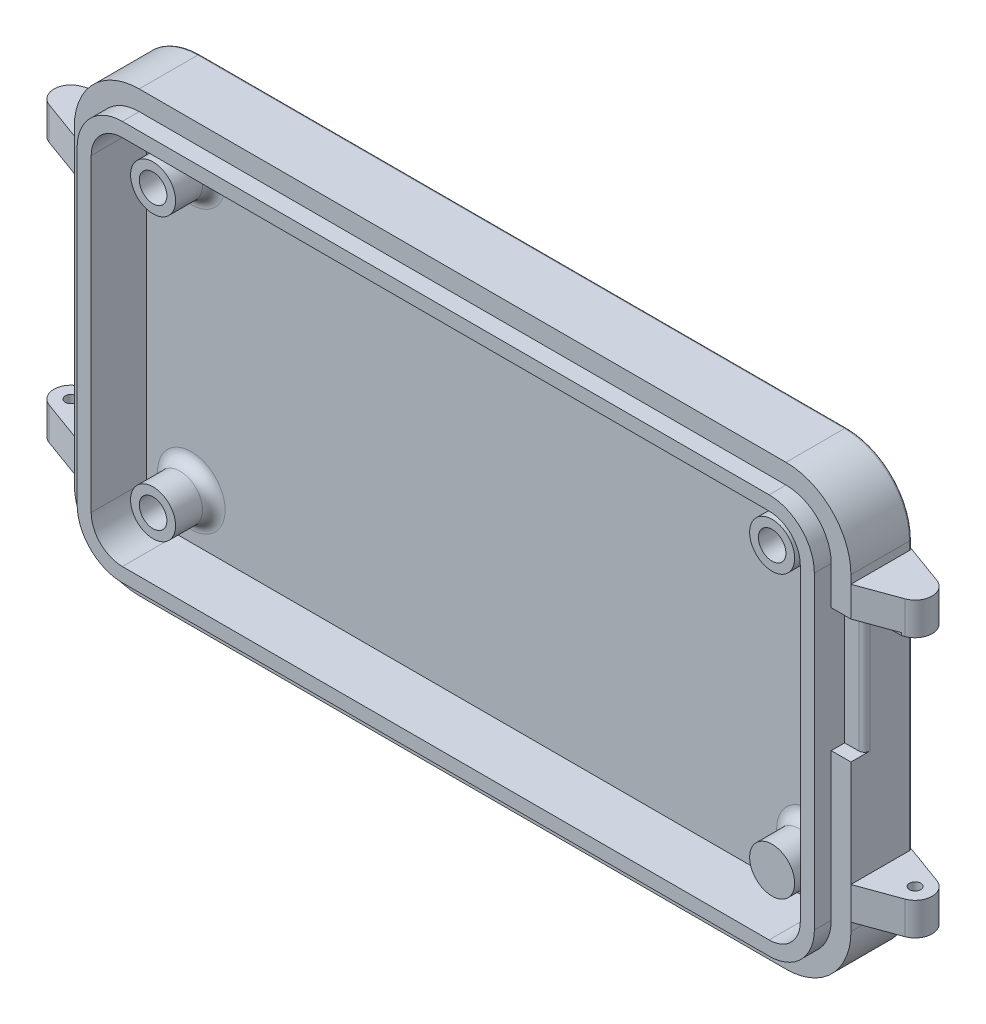
from build123d import *

# Parameters (mm, degrees)
EXTRUDE_1_DEPTH                 = 2
SKETCH_2_R                      = 2
SKETCH_2_R_2                    = 1.225
EXTRUDE_2_DEPTH                 = 3.4
FILLET_1_R                      = 1
EXTRUDE_3_DEPTH                 = 3.4
EXTRUDE_4_DEPTH                 = 1.5
EXTRUDE_START                   = -13
EXTRUDE_5_OUTLINE_R             = 0.5
EXTRUDE_5_DEPTH                 = 26
SKETCH_7_R                      = 0.5
EXTRUDE_6_DEPTH                 = 1
SKETCH_6_5_R                    = 1.511110367
CUT_EXTRUDE_2_DEPTH             = 10.1
CUT_EXTRUDE_START               = -10.1
CUT_EXTRUDE_3_DEPTH             = 20.2
EXTRUDE_START_2                 = -1
SKETCH_8_R                      = 0.5
EXTRUDE_7_DEPTH                 = 1
FILLET_12_R                     = 0.2
FILLET_13_R                     = 0.2
FILLET_14_R                     = 0.2
FILLET_15_R                     = 0.2
CUT_EXTRUDE_4_REACH             = 98.601
SKETCH_9_W                      = 8
SKETCH_9_H                      = 11
CUT_EXTRUDE_4_DIRECTION_2_DEPTH = 10
FILLET_20_R                     = 0.5


# Read off the part's stored shape, not the designer's step: 填料-伸長5, 除料-伸長3
with BuildPart() as part:
    # 草圖1 → 填料-伸長1 (new body)
    # profile 1 of 2: a face of its own
    with BuildSketch(Plane(origin=(0, 0, 52.444102468), x_dir=(-1, 0, 0), z_dir=(0, 0, -1))):
        with BuildLine():
            Line((-31.373871627, -18.844561135), (26.086442071, -18.844561135))
            ThreePointArc((26.086442071, -18.844561135), (30.166267544, -17.154541644), (31.856287034, -13.074716171))
            Line((31.856287034, -13.074716171), (31.856287035, 14.385591758))
            ThreePointArc((31.856287035, 14.385591758), (30.166268145, 18.465419031), (26.08644126, 20.155438855))
            Line((26.08644126, 20.155438855), (-31.373870816, 20.155438854))
            ThreePointArc((-31.373870816, 20.155438854), (-35.453692779, 18.465418678), (-37.143712955, 14.385596715))
            Line((-37.143712955, 14.385596715), (-37.143712955, -13.074721129))
            ThreePointArc((-37.143712955, -13.074721129), (-35.453692177, -17.154541292), (-31.373871627, -18.844561135))
        make_face()
        with BuildLine():
            ThreePointArc((26.086287059, -14.34456114), (26.984287031, -13.972561131), (27.35628704, -13.074561159))
            Line((27.35628704, -13.074561159), (27.35628704, 14.385438402))
            ThreePointArc((27.35628704, 14.385438402), (26.984287334, 15.283438817), (26.086287059, 15.65543886))
            Line((26.086287059, 15.65543886), (-31.373712502, 15.65543886))
            ThreePointArc((-31.373712502, 15.65543886), (-32.271712266, 15.283438166), (-32.64371296, 14.385438402))
            Line((-32.64371296, 14.385438402), (-32.64371296, -13.074561159))
            ThreePointArc((-32.64371296, -13.074561159), (-32.271711963, -13.97256048), (-31.373712502, -14.34456114))
            Line((-31.373712502, -14.34456114), (26.086287059, -14.34456114))
        make_face(mode=Mode.SUBTRACT)
    # profile 2 of 2: a face of its own
    with BuildSketch(Plane(origin=(0, 0, 52.444102468), x_dir=(-1, 0, 0), z_dir=(0, 0, -1))):
        with BuildLine():
            Line((-31.373712502, -14.34456114), (26.086287059, -14.34456114))
            ThreePointArc((26.086287059, -14.34456114), (26.984287031, -13.972561131), (27.35628704, -13.074561159))
            Line((27.35628704, -13.074561159), (27.35628704, 14.385438402))
            ThreePointArc((27.35628704, 14.385438402), (26.984287334, 15.283438817), (26.086287059, 15.65543886))
            Line((26.086287059, 15.65543886), (-31.373712502, 15.65543886))
            ThreePointArc((-31.373712502, 15.65543886), (-32.271712266, 15.283438166), (-32.64371296, 14.385438402))
            Line((-32.64371296, 14.385438402), (-32.64371296, -13.074561159))
            ThreePointArc((-32.64371296, -13.074561159), (-32.271711963, -13.97256048), (-31.373712502, -14.34456114))
        make_face()
    extrude(amount=-EXTRUDE_1_DEPTH)

    # 草圖2 → 填料-伸長2 (add)
    # profile 1 of 4: a face of its own
    with BuildSketch(Plane.XY.offset(54.444102468)):
        with Locations(Location((-24.85628696, -11.84456106, 0), (0, 0, 180))):
            Circle(SKETCH_2_R)
        with Locations((-24.85628696, -11.84456106)):
            Circle(SKETCH_2_R_2, mode=Mode.SUBTRACT)
    # profile 2 of 4: a face of its own
    with BuildSketch(Plane.XY.offset(54.444102468)):
        with Locations(Location((-24.85628696, 13.15543974, 0), (0, 0, 180))):
            Circle(SKETCH_2_R)
        with Locations((-24.85628696, 13.15543974)):
            Circle(SKETCH_2_R_2, mode=Mode.SUBTRACT)
    # profile 3 of 4: a face of its own
    with BuildSketch(Plane.XY.offset(54.444102468)):
        with Locations(Location((30.14371226, 13.15543974, 0), (0, 0, 180))):
            Circle(SKETCH_2_R)
        with Locations((30.14371226, 13.15543974)):
            Circle(SKETCH_2_R_2, mode=Mode.SUBTRACT)
    # profile 4 of 4: a face of its own
    with BuildSketch(Plane.XY.offset(54.444102468)):
        with Locations(Location((30.14371304, -11.84456026, 0), (0, 0, 180))):
            Circle(SKETCH_2_R)
    extrude(amount=EXTRUDE_2_DEPTH)

    # 圓角1
    fillet_1_edges = [part.edges().sort_by_distance(p)[0] for p in [
        (32.14371226, 13.15543974, 54.444102468),
        (-22.85628696, 13.15543974, 54.444102468),
        (-22.85628696, -11.84456106, 54.444102468),
        (32.14371304, -11.84456026, 54.444102468),
    ]]
    fillet(fillet_1_edges, radius=FILLET_1_R)

    # 草圖4 → 填料-伸長3 (add)
    with BuildSketch(Plane.XY.offset(54.444102468)):
        with BuildLine():
            Line((-26.086442071, -18.844561135), (31.373871627, -18.844561135))
            ThreePointArc((31.373871627, -18.844561135), (35.453692178, -17.154541292), (37.143712955, -13.074721129))
            Line((37.143712955, -13.074721129), (37.143712955, 14.385596715))
            ThreePointArc((37.143712955, 14.385596715), (35.453692779, 18.465418678), (31.373870816, 20.155438854))
            Line((31.373870816, 20.155438854), (-26.08644126, 20.155438855))
            ThreePointArc((-26.08644126, 20.155438855), (-30.166268145, 18.465419031), (-31.856287035, 14.385591758))
            Line((-31.856287035, 14.385591758), (-31.856287034, -13.074716171))
            ThreePointArc((-31.856287034, -13.074716171), (-30.166267544, -17.154541644), (-26.086442071, -18.844561135))
        make_face()
        with BuildLine():
            Line((-26.086287059, -15.84456114), (31.373818586, -15.844561136))
            ThreePointArc((31.373818586, -15.844561136), (33.332409641, -15.033183146), (34.14371296, -13.074561159))
            Line((34.14371296, -13.074561159), (34.143712957, 14.385543944))
            ThreePointArc((34.143712957, 14.385543944), (33.332335123, 16.344135652), (31.373712502, 17.15543886))
            Line((31.373712502, 17.15543886), (-26.086389859, 17.155438856))
            ThreePointArc((-26.086389859, 17.155438856), (-28.044983851, 16.344062643), (-28.85628704, 14.385438402))
            Line((-28.85628704, 14.385438402), (-28.856287036, -13.074664501))
            ThreePointArc((-28.856287036, -13.074664501), (-28.044910666, -15.033257839), (-26.086287059, -15.84456114))
        make_face(mode=Mode.SUBTRACT)
    extrude(amount=EXTRUDE_3_DEPTH)

    # 草圖5 → 填料-伸長4 (add)
    with BuildSketch(Plane.XY.offset(57.844102468)):
        with BuildLine():
            Line((-30.10628704, 14.385457934), (-30.106287034, -13.07470756))
            ThreePointArc((-30.106287034, -13.07470756), (-28.928785898, -15.917149559), (-26.086306801, -17.094561141))
            Line((-26.086306801, -17.094561141), (31.373862787, -17.094561134))
            ThreePointArc((31.373862787, -17.094561134), (34.21630154, -15.917058196), (35.39371296, -13.074581533))
            Line((35.39371296, -13.074581533), (35.393712954, 14.38558792))
            ThreePointArc((35.393712954, 14.38558792), (34.216210178, 17.228027546), (31.373732665, 18.40543886))
            Line((31.373732665, 18.40543886), (-26.086432693, 18.405438854))
            ThreePointArc((-26.086432693, 18.405438854), (-28.928875564, 17.227937879), (-30.10628704, 14.385457934))
        make_face()
        with BuildLine():
            Line((-28.85628704, 14.385438402), (-28.856287036, -13.074664501))
            ThreePointArc((-28.856287036, -13.074664501), (-28.044910666, -15.033257839), (-26.086287059, -15.844561141))
            Line((-26.086287059, -15.844561141), (31.373818586, -15.844561136))
            ThreePointArc((31.373818586, -15.844561136), (33.33240964, -15.033183145), (34.143712961, -13.074561159))
            Line((34.143712961, -13.074561159), (34.143712956, 14.385543944))
            ThreePointArc((34.143712956, 14.385543944), (33.332335122, 16.344135651), (31.373712502, 17.15543886))
            Line((31.373712502, 17.15543886), (-26.086389859, 17.155438855))
            ThreePointArc((-26.086389859, 17.155438855), (-28.04498385, 16.344062642), (-28.85628704, 14.385438402))
        make_face(mode=Mode.SUBTRACT)
    extrude(amount=EXTRUDE_4_DEPTH)

    # 填料-伸長5 outline → 填料-伸長5 (add)
    with BuildSketch(Plane(origin=(0, 0.65543886, 0), x_dir=(1, 0, 0), z_dir=(0, 1, 0)).offset(EXTRUDE_START)):
        with BuildLine():
            Line((37.143712955, -52.444102468), (37.143712955, -57.844102468))
            Line((37.143712955, -57.844102468), (40.660543139, -56.564081729))
            ThreePointArc((40.660543139, -56.564081729), (41.654823322, -55.144102468), (40.660543139, -53.724123206))
            Line((40.660543139, -53.724123206), (37.143712955, -52.444102468))
        make_face()
        with Locations((40.143712955, -55.144102468)):
            Circle(EXTRUDE_5_OUTLINE_R, mode=Mode.SUBTRACT)
    extrude_5 = extrude(amount=EXTRUDE_5_DEPTH)

    # 草圖7 → 填料-伸長6 (add)
    with BuildSketch(Plane.XZ.offset(12.34456114)):
        with Locations(Location((40.143712955, 55.144102468, 0), (0, 0, 180))):
            Circle(SKETCH_7_R)
    extrude_6 = extrude(amount=-EXTRUDE_6_DEPTH)

    # 草圖6<5> → 除料-伸長2 (cut, symmetric)
    with BuildSketch(Plane(origin=(0, 0.65543886, 0), x_dir=(1, 0, 0), z_dir=(0, 1, 0))):
        with Locations((40.143712955, -55.144102468)):
            Circle(SKETCH_6_5_R)
    cut_extrude_2 = extrude(amount=CUT_EXTRUDE_2_DEPTH, both=True, mode=Mode.SUBTRACT)

    # 除料-伸長3 outline → 除料-伸長3 (cut)
    with BuildSketch(Plane(origin=(0, 0.65543886, 0), x_dir=(1, 0, 0), z_dir=(0, 1, 0)).offset(CUT_EXTRUDE_START)):
        with BuildLine():
            Line((40.660543139, -53.724123206), (37.143712955, -52.444102468))
            Line((37.143712955, -52.444102468), (37.143712955, -57.844102468))
            Line((37.143712955, -57.844102468), (40.660543139, -56.564081729))
            ThreePointArc((40.660543139, -56.564081729), (38.632602587, -55.144102468), (40.660543139, -53.724123206))
        make_face()
    cut_extrude_3 = extrude(amount=CUT_EXTRUDE_3_DEPTH, mode=Mode.SUBTRACT)

    # 草圖8 → 填料-伸長7 (add)
    with BuildSketch(Plane(origin=(0, 13.65543886, 0), x_dir=(1, 0, 0), z_dir=(0, 1, 0)).offset(EXTRUDE_START_2)):
        with Locations(Location((40.143712955, -55.144102468, 0), (0, 0, 180))):
            Circle(SKETCH_8_R)
    extrude_7 = extrude(amount=EXTRUDE_7_DEPTH)

    # 鏡射2: 填料-伸長5, 填料-伸長6, 除料-伸長2, 除料-伸長3, 填料-伸長7 across plane
    add(extrude_5.mirror(Plane.ZY.offset(-2.64371296)))
    add(extrude_6.mirror(Plane.ZY.offset(-2.64371296)))
    add(cut_extrude_2.mirror(Plane.ZY.offset(-2.64371296)), mode=Mode.SUBTRACT)
    add(cut_extrude_3.mirror(Plane.ZY.offset(-2.64371296)), mode=Mode.SUBTRACT)
    add(extrude_7.mirror(Plane.ZY.offset(-2.64371296)))

    # 圓角12
    fillet_12_edges = [part.edges().sort_by_distance(p)[0] for p in [
        (-31.856287034, -12.709638656, 52.444102468),
        (-30.166267544, -17.154541644, 52.444102468),
        (2.643714778, -18.844561135, 52.444102468),
        (37.143712955, -12.709641134, 52.444102468),
        (35.453692177, -17.154541292, 52.444102468),
    ]]
    fillet(fillet_12_edges, radius=FILLET_12_R)

    # 圓角13
    fillet_13_edges = [part.edges().sort_by_distance(p)[0] for p in [
        (37.143712955, 0.65543886, 52.444102468),
    ]]
    fillet(fillet_13_edges, radius=FILLET_13_R)

    # 圓角14
    fillet_14_edges = [part.edges().sort_by_distance(p)[0] for p in [
        (37.143712955, 14.020517788, 52.444102468),
        (35.453692779, 18.465418678, 52.444102468),
        (2.643714778, 20.155438854, 52.444102468),
        (-30.166268145, 18.465419031, 52.444102468),
        (-31.856287035, 14.020515309, 52.444102468),
    ]]
    fillet(fillet_14_edges, radius=FILLET_14_R)

    # 圓角15
    fillet_15_edges = [part.edges().sort_by_distance(p)[0] for p in [
        (-31.856287035, 0.65543886, 52.444102468),
    ]]
    fillet(fillet_15_edges, radius=FILLET_15_R)

    # 除料-伸長4: up to this face of the body (flat: up to its plane)
    cut_extrude_4_end = Plane(part.part.faces().sort_by_distance((35.393712957, 0.655503194, 58.594102468))[0])
    # 草圖9 → 除料-伸長4 (cut, up to the picked face)
    with BuildSketch(Plane(origin=(37.143712955, 0, 0), x_dir=(0, 0, -1), z_dir=(1.0, -3.597222090600559e-12, 0)), mode=Mode.PRIVATE) as cut_extrude_4_sk1:
        with Locations((-60.648457798, 5.480436611)):
            Rectangle(SKETCH_9_W, SKETCH_9_H)
    cut_extrude_4_tool1 = split(extrude(cut_extrude_4_sk1.sketch, amount=-CUT_EXTRUDE_4_REACH, mode=Mode.PRIVATE), bisect_by=cut_extrude_4_end, keep=Keep.BOTH, mode=Mode.PRIVATE)
    add(cut_extrude_4_tool1.solids().sort_by(Axis((37.143713, 5.480437, 60.648458), (-1.0, 3.597222090600559e-12, 0)))[0], mode=Mode.SUBTRACT)

    # 草圖9 → 除料-伸長4 direction 2 (cut)
    with BuildSketch(Plane(origin=(37.143712955, 0, 0), x_dir=(0, 0, -1), z_dir=(1.0, -3.597222090600559e-12, 0))):
        with Locations((-60.648457798, 5.480436611)):
            Rectangle(SKETCH_9_W, SKETCH_9_H)
    extrude(amount=CUT_EXTRUDE_4_DIRECTION_2_DEPTH, mode=Mode.SUBTRACT)

    # 圓角20
    fillet_20_edges = [part.edges().sort_by_distance(p)[0] for p in [
        (37.143712955, 5.367937735, 56.648457798),
    ]]
    fillet(fillet_20_edges, radius=FILLET_20_R)


solid = part.part
